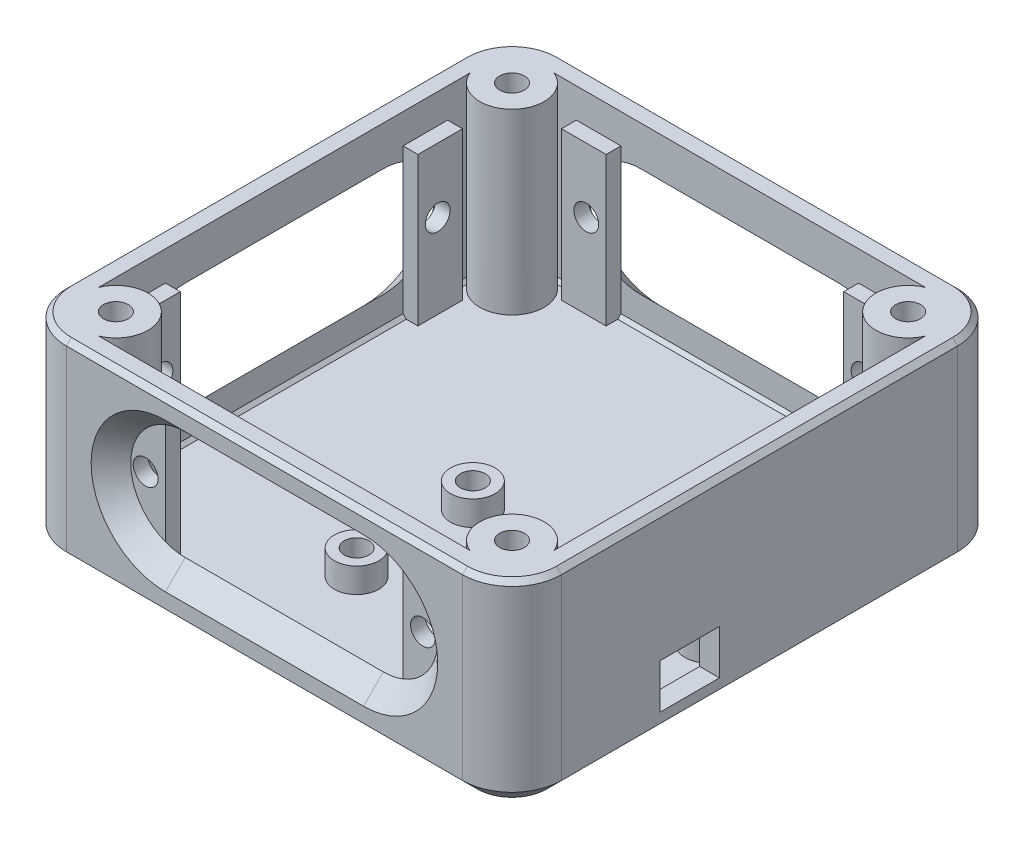
from build123d import *

# Parameters (mm, degrees)
ESQUISSE1_W                            = 100
ESQUISSE1_H                            = 100
BOSS_EXTRU_1_DEPTH                     = 40
CONG_1_R                               = 10
CHANFREIN1_SIZE                        = 3
ESQUISSE4_R                            = 2.5
ENL_V_MAT_EXTRU_1_DEPTH                = 36
COQUE2_START                           = 4
COQUE2_DEPTH                           = 92
COQUE2_2_OUTLINE_R                     = 2.5
COQUE2_2_DEPTH                         = 36
COQUE2_START_2                         = -88
COQUE2_3_DEPTH                         = 76
ESQUISSE5_R                            = 4.5
ESQUISSE5_R_2                          = 2.5
BOSS_EXTRU_2_DEPTH                     = 5
ESQUISSE6_W                            = 12
ESQUISSE6_H                            = 9
ENL_V_MAT_EXTRU_2_DEPTH                = 20
ENL_V_MAT_EXTRU_3_DEPTH                = 4
ENL_V_MAT_EXTRU_3_DRAFT                = -45
ESQUISSE8_W                            = 9
ESQUISSE8_H                            = 3
BOSS_EXTRU_6_DEPTH                     = 30
ESQUISSE9_R                            = 2.5
ENL_V_MAT_EXTRU_4_DEPTH                = 3.5
R_P_TITION_CIRCULAIRE1_COUNT           = 3
R_P_TITION_CIRCULAIRE1_ANGLE           = 180
R_P_TITION_CIRCULAIRE1_COPY_1_DEPTH    = 4
R_P_TITION_CIRCULAIRE1_COPY_1_DRAFT    = -45
R_P_TITION_CIRCULAIRE1_COPY_2_DEPTH    = 4
R_P_TITION_CIRCULAIRE1_COPY_2_DRAFT    = -45
R_P_TITION_CIRCULAIRE1_COPY_3_SKETCH_W = 9
R_P_TITION_CIRCULAIRE1_COPY_3_SKETCH_H = 3
R_P_TITION_CIRCULAIRE1_COPY_3_DEPTH    = 30
R_P_TITION_CIRCULAIRE1_COPY_4_SKETCH_W = 9
R_P_TITION_CIRCULAIRE1_COPY_4_SKETCH_H = 3
R_P_TITION_CIRCULAIRE1_COPY_4_DEPTH    = 30
R_P_TITION_CIRCULAIRE1_COPY_5_SKETCH_R = 2.5
R_P_TITION_CIRCULAIRE1_COPY_5_DEPTH    = 3.5
R_P_TITION_CIRCULAIRE1_COPY_6_SKETCH_R = 2.5
R_P_TITION_CIRCULAIRE1_COPY_6_DEPTH    = 3.5
ENL_V_MAT_EXTRU_5_DEPTH                = 97
CHANFREIN2_SIZE                        = 1


with BuildPart() as part:
    # Esquisse1 → Boss.-Extru.1 (new body)
    with BuildSketch(Plane(origin=(0, 0, 0), x_dir=(1, 0, 0), z_dir=(0, 1, 0))):
        with Locations((50, 50)):
            Rectangle(ESQUISSE1_W, ESQUISSE1_H)
    extrude(amount=BOSS_EXTRU_1_DEPTH)

    # Congé1
    cong_1_edges = [part.edges().sort_by_distance(p)[0] for p in [
        (0, 20, -100),
        (100, 20, -100),
        (100, 20, 0),
        (0, 20, 0),
    ]]
    fillet(cong_1_edges, radius=CONG_1_R)

    # Chanfrein1
    chanfrein1_edges = [part.edges().sort_by_distance(p)[0] for p in [
        (50, 0, -100),
        (0, 0, -50),
        (100, 0, -50),
        (50, 0, 0),
        (97.071067812, 0, -2.928932188),
        (2.928932188, 0, -2.928932188),
        (2.928932188, 0, -97.071067812),
        (97.071067812, 0, -97.071067812),
    ]]
    chamfer(chanfrein1_edges, length=CHANFREIN1_SIZE)

    # Esquisse4 → Enlèv. mat.-Extru.1 (cut)
    with BuildSketch(Plane(origin=(0, 40, 0), x_dir=(1, 0, 0), z_dir=(0, 1, 0))):
        with Locations(Location((10, 90, 0), (0, 0, 270))):
            Circle(ESQUISSE4_R)
        with Locations(Location((10, 10, 0), (0, 0, 90))):
            Circle(ESQUISSE4_R)
        with Locations(Location((90, 10, 0), (0, 0, 270))):
            Circle(ESQUISSE4_R)
        with Locations(Location((90, 90, 0), (0, 0, 90))):
            Circle(ESQUISSE4_R)
    extrude(amount=-ENL_V_MAT_EXTRU_1_DEPTH, mode=Mode.SUBTRACT)

    # Coque2: read off the stored shape, not the designer's step
    # Coque2 outline → Coque2 (cut)
    with BuildSketch(Plane.YZ.offset(COQUE2_START)):
        Polygon((4.656854249, -4), (4, -4.656854249), (4, -95.343145751), (4.656854249, -96), (40, -96), (40, -4), align=None)
    extrude(amount=COQUE2_DEPTH, mode=Mode.SUBTRACT)

    # Coque2 2 outline → Coque2 2 (add)
    # profile 1 of 4: a face of its own
    with BuildSketch(Plane(origin=(0, 0, 0), x_dir=(1, 0, 0), z_dir=(0, 1, 0)).offset(COQUE2_START)):
        with BuildLine():
            Line((96, 96), (87.5, 96))
            ThreePointArc((87.5, 96), (85.403805922, 85.403805922), (96, 87.5))
            Line((96, 87.5), (96, 96))
        make_face()
        with Locations((90, 90)):
            Circle(COQUE2_2_OUTLINE_R, mode=Mode.SUBTRACT)
    # profile 2 of 4: a face of its own
    with BuildSketch(Plane(origin=(0, 0, 0), x_dir=(1, 0, 0), z_dir=(0, 1, 0)).offset(COQUE2_START)):
        with BuildLine():
            ThreePointArc((4, 87.5), (14.596194078, 85.403805922), (12.5, 96))
            Line((12.5, 96), (4, 96))
            Line((4, 96), (4, 87.5))
        make_face()
        with Locations((10, 90)):
            Circle(COQUE2_2_OUTLINE_R, mode=Mode.SUBTRACT)
    # profile 3 of 4: a face of its own
    with BuildSketch(Plane(origin=(0, 0, 0), x_dir=(1, 0, 0), z_dir=(0, 1, 0)).offset(COQUE2_START)):
        with BuildLine():
            Line((96, 4), (96, 12.5))
            ThreePointArc((96, 12.5), (85.403805922, 14.596194078), (87.5, 4))
            Line((87.5, 4), (96, 4))
        make_face()
        with Locations((90, 10)):
            Circle(COQUE2_2_OUTLINE_R, mode=Mode.SUBTRACT)
    # profile 4 of 4: a face of its own
    with BuildSketch(Plane(origin=(0, 0, 0), x_dir=(1, 0, 0), z_dir=(0, 1, 0)).offset(COQUE2_START)):
        with BuildLine():
            ThreePointArc((12.5, 4), (14.596194078, 14.596194078), (4, 12.5))
            Line((4, 12.5), (4, 4))
            Line((4, 4), (12.5, 4))
        make_face()
        with Locations((10, 10)):
            Circle(COQUE2_2_OUTLINE_R, mode=Mode.SUBTRACT)
    extrude(amount=COQUE2_2_DEPTH)

    # Coque2 3 outline → Coque2 3 (add)
    with BuildSketch(Plane.XY.offset(COQUE2_START_2)):
        Polygon((4, 4), (4.656854249, 4), (4, 4.656854249), align=None)
        Polygon((96, 4.656854249), (95.343145751, 4), (96, 4), align=None)
    extrude(amount=COQUE2_3_DEPTH)

    # Esquisse5 → Boss.-Extru.2 (add)
    # profile 1 of 4: a face of its own
    with BuildSketch(Plane(origin=(0, 4, 0), x_dir=(1, 0, 0), z_dir=(0, 1, 0))):
        with Locations(Location((44.6195999, 47.4737, 0), (0, 0, 90))):
            Circle(ESQUISSE5_R)
        with Locations(Location((44.6195999, 47.4737, 0), (0, 0, 270))):
            Circle(ESQUISSE5_R_2, mode=Mode.SUBTRACT)
    # profile 2 of 4: a face of its own
    with BuildSketch(Plane(origin=(0, 4, 0), x_dir=(1, 0, 0), z_dir=(0, 1, 0))):
        with Locations(Location((44.6195999, 24, 0), (0, 0, 90))):
            Circle(ESQUISSE5_R)
        with Locations(Location((44.6195999, 24, 0), (0, 0, 270))):
            Circle(ESQUISSE5_R_2, mode=Mode.SUBTRACT)
    # profile 3 of 4: a face of its own
    with BuildSketch(Plane(origin=(0, 4, 0), x_dir=(1, 0, 0), z_dir=(0, 1, 0))):
        with Locations((92, 24)):
            Circle(ESQUISSE5_R)
        with Locations(Location((92, 24, 0), (0, 0, 270))):
            Circle(ESQUISSE5_R_2, mode=Mode.SUBTRACT)
    # profile 4 of 4: a face of its own
    with BuildSketch(Plane(origin=(0, 4, 0), x_dir=(1, 0, 0), z_dir=(0, 1, 0))):
        with Locations((92, 47.4737)):
            Circle(ESQUISSE5_R)
        with Locations(Location((92, 47.4737, 0), (0, 0, 270))):
            Circle(ESQUISSE5_R_2, mode=Mode.SUBTRACT)
    extrude(amount=BOSS_EXTRU_2_DEPTH)

    # Esquisse6 → Enlèv. mat.-Extru.2 (cut)
    with BuildSketch(Plane(origin=(100, 0, 0), x_dir=(0, 0, -1), z_dir=(1, 0, 0))):
        with Locations((35.9, 9.5)):
            Rectangle(ESQUISSE6_W, ESQUISSE6_H)
    extrude(amount=-ENL_V_MAT_EXTRU_2_DEPTH, mode=Mode.SUBTRACT)


with BuildPart() as enl_v_mat_extru_3_tool:
    # Esquisse7 → Enlèv. mat.-Extru.3 (with draft: the straight prism first)
    with BuildSketch(Plane(origin=(0, 0, -100), x_dir=(-1, 0, 0), z_dir=(0, 0, -1))):
        with BuildLine():
            ThreePointArc((-30, 6), (-15, 21), (-30, 36))
            Line((-30, 36), (-70, 36))
            ThreePointArc((-70, 36), (-85, 21), (-70, 6))
            Line((-70, 6), (-30, 6))
        make_face()
    extrude(amount=-ENL_V_MAT_EXTRU_3_DEPTH)
    # Enlèv. mat.-Extru.3: the draft: its side faces are tilted about the plane it starts from
    enl_v_mat_extru_3_sides = [enl_v_mat_extru_3_tool.faces().sort_by_distance(p)[0] for p in [
        (15, 21, -98),
        (50, 36, -98),
        (85, 21, -98),
        (50, 6, -98),
    ]]
    draft(enl_v_mat_extru_3_sides, Plane(origin=(0, 0, -100), x_dir=(-1, 0, 0), z_dir=(0, 0, -1)), ENL_V_MAT_EXTRU_3_DRAFT)


with BuildPart() as part_1:
    add(part.part)

    # Enlèv. mat.-Extru.3: cut by enl_v_mat_extru_3_tool
    add(enl_v_mat_extru_3_tool.part, mode=Mode.SUBTRACT)

    # Esquisse8 → Boss.-Extru.6 (add)
    with BuildSketch(Plane(origin=(0, 4, 0), x_dir=(1, 0, 0), z_dir=(0, 1, 0))):
        with Locations((78.5, 94.5)):
            Rectangle(ESQUISSE8_W, ESQUISSE8_H)
    boss_extru_6 = extrude(amount=BOSS_EXTRU_6_DEPTH)

    # Esquisse9 → Enlèv. mat.-Extru.4 (cut)
    with BuildSketch(Plane(origin=(0, 0, -96), x_dir=(-1, 0, 0), z_dir=(0, 0, -1))):
        with Locations((-78, 21)):
            Circle(ESQUISSE9_R)
    enl_v_mat_extru_4 = extrude(amount=-ENL_V_MAT_EXTRU_4_DEPTH, mode=Mode.SUBTRACT)

    # Symétrie1: Boss.-Extru.6, Enlèv. mat.-Extru.4 across plane
    add(boss_extru_6.mirror(Plane(origin=(50, 0, 0), x_dir=(0, 0, 1), z_dir=(1, 0, 0))))
    add(enl_v_mat_extru_4.mirror(Plane(origin=(50, 0, 0), x_dir=(0, 0, 1), z_dir=(1, 0, 0))), mode=Mode.SUBTRACT)

    # Répétition circulaire1: Boss.-Extru.6, Enlèv. mat.-Extru.4 ×3 about axis
    r_p_tition_circulaire1_axis = Axis((50, 0, -50), (0, 1, 0))
    add([boss_extru_6.rotate(r_p_tition_circulaire1_axis, i * R_P_TITION_CIRCULAIRE1_ANGLE / (R_P_TITION_CIRCULAIRE1_COUNT - 1)) for i in range(1, R_P_TITION_CIRCULAIRE1_COUNT)])
    add([enl_v_mat_extru_4.rotate(r_p_tition_circulaire1_axis, i * R_P_TITION_CIRCULAIRE1_ANGLE / (R_P_TITION_CIRCULAIRE1_COUNT - 1)) for i in range(1, R_P_TITION_CIRCULAIRE1_COUNT)], mode=Mode.SUBTRACT)


with BuildPart() as r_p_tition_circulaire1_copy_1_tool:
    # Répétition circulaire1 copy 1 sketch → Répétition circulaire1 copy 1 (with draft: the straight prism first)
    with BuildSketch(Plane.ZY):
        with BuildLine():
            ThreePointArc((-30, 6), (-15, 21), (-30, 36))
            Line((-30, 36), (-70, 36))
            ThreePointArc((-70, 36), (-85, 21), (-70, 6))
            Line((-70, 6), (-30, 6))
        make_face()
    extrude(amount=-R_P_TITION_CIRCULAIRE1_COPY_1_DEPTH)
    # Répétition circulaire1 copy 1: the draft: its side faces are tilted about the plane it starts from
    r_p_tition_circulaire1_copy_1_sides = [r_p_tition_circulaire1_copy_1_tool.faces().sort_by_distance(p)[0] for p in [
        (2, 21, -15),
        (2, 36, -50),
        (2, 21, -85),
        (2, 6, -50),
    ]]
    draft(r_p_tition_circulaire1_copy_1_sides, Plane.ZY, R_P_TITION_CIRCULAIRE1_COPY_1_DRAFT)


with BuildPart() as part_2:
    add(part_1.part)

    # Répétition circulaire1 copy 1: cut by r_p_tition_circulaire1_copy_1_tool
    add(r_p_tition_circulaire1_copy_1_tool.part, mode=Mode.SUBTRACT)


with BuildPart() as r_p_tition_circulaire1_copy_2_tool:
    # Répétition circulaire1 copy 2 sketch → Répétition circulaire1 copy 2 (with draft: the straight prism first)
    with BuildSketch(Plane(origin=(100, 0, 0), x_dir=(1, 0, 0), z_dir=(0, 0, 1))):
        with BuildLine():
            ThreePointArc((-30, 6), (-15, 21), (-30, 36))
            Line((-30, 36), (-70, 36))
            ThreePointArc((-70, 36), (-85, 21), (-70, 6))
            Line((-70, 6), (-30, 6))
        make_face()
    extrude(amount=-R_P_TITION_CIRCULAIRE1_COPY_2_DEPTH)
    # Répétition circulaire1 copy 2: the draft: its side faces are tilted about the plane it starts from
    r_p_tition_circulaire1_copy_2_sides = [r_p_tition_circulaire1_copy_2_tool.faces().sort_by_distance(p)[0] for p in [
        (85, 21, -2),
        (50, 36, -2),
        (15, 21, -2),
        (50, 6, -2),
    ]]
    draft(r_p_tition_circulaire1_copy_2_sides, Plane(origin=(100, 0, 0), x_dir=(1, 0, 0), z_dir=(0, 0, 1)), R_P_TITION_CIRCULAIRE1_COPY_2_DRAFT)


with BuildPart() as part_3:
    add(part_2.part)

    # Répétition circulaire1 copy 2: cut by r_p_tition_circulaire1_copy_2_tool
    add(r_p_tition_circulaire1_copy_2_tool.part, mode=Mode.SUBTRACT)

    # Répétition circulaire1 copy 3 sketch → Répétition circulaire1 copy 3 (add)
    with BuildSketch(Plane(origin=(100, 4, -100), x_dir=(0, 0, 1), z_dir=(0, 1, 0))):
        with Locations((78.5, -94.5)):
            Rectangle(R_P_TITION_CIRCULAIRE1_COPY_3_SKETCH_W, R_P_TITION_CIRCULAIRE1_COPY_3_SKETCH_H)
    extrude(amount=R_P_TITION_CIRCULAIRE1_COPY_3_DEPTH)

    # Répétition circulaire1 copy 4 sketch → Répétition circulaire1 copy 4 (add)
    with BuildSketch(Plane(origin=(0, 4, -100), x_dir=(1, 0, 0), z_dir=(0, 1, 0))):
        with Locations((78.5, -94.5)):
            Rectangle(R_P_TITION_CIRCULAIRE1_COPY_4_SKETCH_W, R_P_TITION_CIRCULAIRE1_COPY_4_SKETCH_H)
    extrude(amount=R_P_TITION_CIRCULAIRE1_COPY_4_DEPTH)

    # Répétition circulaire1 copy 5 sketch → Répétition circulaire1 copy 5 (cut)
    with BuildSketch(Plane(origin=(4, 0, -100), x_dir=(0, 0, -1), z_dir=(-1, 0, 0))):
        with Locations((-78, -21)):
            Circle(R_P_TITION_CIRCULAIRE1_COPY_5_SKETCH_R)
    extrude(amount=-R_P_TITION_CIRCULAIRE1_COPY_5_DEPTH, mode=Mode.SUBTRACT)

    # Répétition circulaire1 copy 6 sketch → Répétition circulaire1 copy 6 (cut)
    with BuildSketch(Plane(origin=(0, 0, -4), x_dir=(-1, 0, 0), z_dir=(0, 0, 1))):
        with Locations((-78, -21)):
            Circle(R_P_TITION_CIRCULAIRE1_COPY_6_SKETCH_R)
    extrude(amount=-R_P_TITION_CIRCULAIRE1_COPY_6_DEPTH, mode=Mode.SUBTRACT)

    # Esquisse11 → Enlèv. mat.-Extru.5 (cut)
    with BuildSketch(Plane(origin=(100, 0, 0), x_dir=(0, 0, -1), z_dir=(1, 0, 0))):
        Polygon((60, 3), (63, 0), (87, 0), (90, 3), align=None)
    extrude(amount=-ENL_V_MAT_EXTRU_5_DEPTH, mode=Mode.SUBTRACT)

    # Chanfrein2
    chanfrein2_edges = [part_3.edges().sort_by_distance(p)[0] for p in [
        (50, 40, -100),
        (100, 40, -50),
        (0, 40, -50),
        (50, 40, 0),
        (97.071067812, 40, -2.928932188),
        (2.928932188, 40, -2.928932188),
        (2.928932188, 40, -97.071067812),
        (97.071067812, 40, -97.071067812),
    ]]
    chamfer(chanfrein2_edges, length=CHANFREIN2_SIZE)


solid = part_3.part
